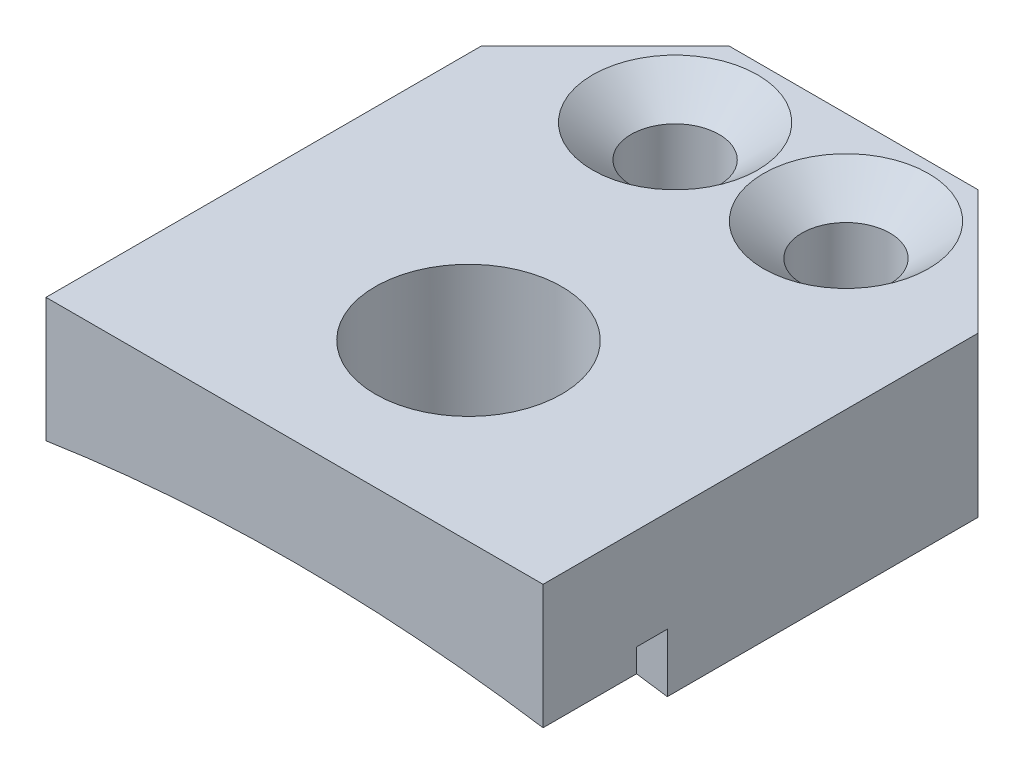
from build123d import *

# Parameters (mm, degrees)
BOSS_EXTRUDE1_DEPTH                               = 6.35
CUT_EXTRUDE1_DEPTH                                = 41.862908972
CUT_EXTRUDE1_DEPTH_BACK                           = 41.862908972
SKETCH2_R                                         = 83.82
BOSS_EXTRUDE2_DEPTH                               = 22.225
CHAMFER1_SIZE                                     = 6.35
CSK_FOR_8_FLAT_HEAD_MACHINE_SCREW_100_D           = 4.4958
CSK_FOR_8_FLAT_HEAD_MACHINE_SCREW_100_CSINK_D     = 8.4328
CSK_FOR_8_FLAT_HEAD_MACHINE_SCREW_100_CSINK_ANGLE = 100
SKETCH6_R                                         = 1.524
CUT_EXTRUDE2_DEPTH                                = 34.704349441
SKETCH7_W                                         = 1.5875
SKETCH7_H                                         = 2.989850087
CUT_EXTRUDE3_DEPTH                                = 31.694162248
SKETCH8_R                                         = 4.7625
CUT_EXTRUDE4_DEPTH                                = 34.704349441


with BuildPart() as part:
    # Sketch1 → Boss-Extrude1 (new body)
    with BuildSketch(Plane(origin=(0, 0, 0), x_dir=(1, 0, 0), z_dir=(0, 1, 0))):
        Polygon((-28.511825699, 9.670271113), (-22.161825699, 16.020271113), (-9.461825699, 16.020271113), (-3.111825699, 9.670271113), (-3.111825699, -12.554728887), (-28.511825699, -12.554728887), align=None)
    extrude(amount=BOSS_EXTRUDE1_DEPTH)

    # Sketch2 → Cut-Extrude1 (cut, two sides: drawn at the far end of the back side and taken through both)
    with BuildSketch(Plane.XY.offset(12.554728887).offset(-CUT_EXTRUDE1_DEPTH_BACK)):
        with Locations((-15.811825699, -82.852292666)):
            Circle(SKETCH2_R)
    extrude(amount=CUT_EXTRUDE1_DEPTH + CUT_EXTRUDE1_DEPTH_BACK, mode=Mode.SUBTRACT)

    # Sketch5 → Boss-Extrude2 (add)
    with BuildSketch(Plane(origin=(0, 0, -16.020271113), x_dir=(-1, 0, 0), z_dir=(0, 0, -1))):
        with BuildLine():
            Line((3.111825699, 6.35), (3.111825699, 0))
            Line((3.111825699, 0), (3.111825699, -1.799225087))
            ThreePointArc((3.111825699, -1.799225087), (15.811825699, -0.810292666), (28.511825699, -1.799225087))
            Line((28.511825699, -1.799225087), (28.511825699, 0))
            Line((28.511825699, 0), (28.511825699, 6.35))
            Line((28.511825699, 6.35), (3.111825699, 6.35))
        make_face()
    extrude(amount=-BOSS_EXTRUDE2_DEPTH)

    # Chamfer1
    chamfer1_edges = [part.edges().sort_by_distance(p)[0] for p in [
        (-28.511825699, 2.275387457, -16.020271113),
        (-3.111825699, 2.275387457, -16.020271113),
    ]]
    chamfer(chamfer1_edges, length=CHAMFER1_SIZE)

    # CSK for #8 Flat Head Machine Screw (100)1 (through all)
    with Locations(Plane(origin=(0, 6.35, 0), x_dir=(1, 0, 0), z_dir=(0, 1, 0))):
        with Locations((-20.177450699, 11.257771113), (-11.446200699, 11.257771113)):
            CounterSinkHole(CSK_FOR_8_FLAT_HEAD_MACHINE_SCREW_100_D / 2, CSK_FOR_8_FLAT_HEAD_MACHINE_SCREW_100_CSINK_D / 2, counter_sink_angle=CSK_FOR_8_FLAT_HEAD_MACHINE_SCREW_100_CSINK_ANGLE)

    # Sketch6 → Cut-Extrude2 (cut, through all)
    with BuildSketch(Plane(origin=(0, 6.35, 0), x_dir=(1, 0, 0), z_dir=(0, 1, 0))):
        with Locations((-15.811825699, -3.664728887)):
            Circle(SKETCH6_R)
    extrude(amount=-CUT_EXTRUDE2_DEPTH, mode=Mode.SUBTRACT)

    # Sketch7 → Cut-Extrude3 (cut, through all)
    with BuildSketch(Plane(origin=(-3.111825699, 0, 0), x_dir=(0, 0, -1), z_dir=(1, 0, 0))):
        with Locations((-6.998478887, -0.304300044)):
            Rectangle(SKETCH7_W, SKETCH7_H)
    extrude(amount=-CUT_EXTRUDE3_DEPTH, mode=Mode.SUBTRACT)

    # Sketch8 → Cut-Extrude4 (cut, through all)
    with BuildSketch(Plane(origin=(0, 6.35, 0), x_dir=(1, 0, 0), z_dir=(0, 1, 0))):
        with Locations((-15.811825699, -3.664728887)):
            Circle(SKETCH8_R)
    extrude(amount=-CUT_EXTRUDE4_DEPTH, mode=Mode.SUBTRACT)


solid = part.part
